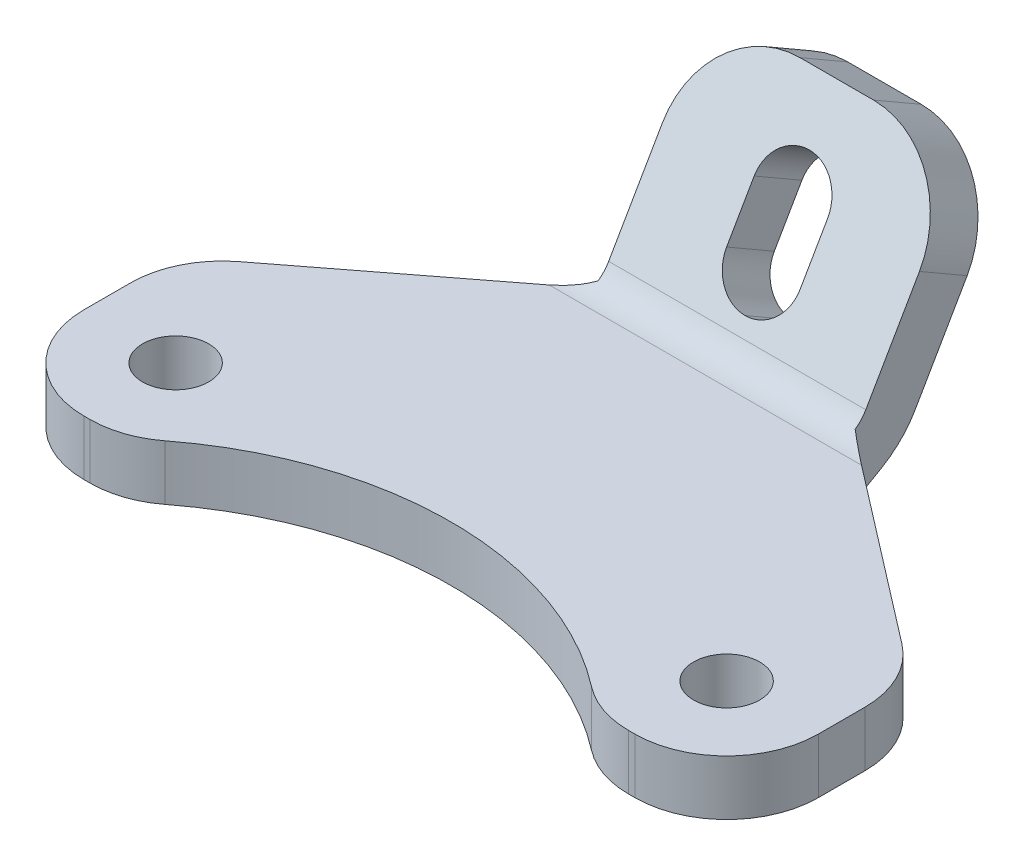
from build123d import *

# Parameters (mm, degrees)
BOSS_EXTRUDE1_DEPTH = 3
SKETCH3_R           = 1.8
CUT_EXTRUDE1_DEPTH  = 3
SKETCH4_W           = 14
SKETCH4_H           = 12
BOSS_EXTRUDE2_DEPTH = 3
BOSS_EXTRUDE3_DEPTH = 14
SKETCH6_W           = 4
SKETCH6_H           = 7
CUT_EXTRUDE2_DEPTH  = 3
FILLET1_R           = 2
FILLET2_R           = 5
FILLET3_R           = 5
FILLET4_R           = 5
SKETCH7_R           = 19
CUT_EXTRUDE3_DEPTH  = 3
FILLET5_R           = 5
FILLET7_R           = 2


with BuildPart() as part:
    # Sketch2 → Boss-Extrude1 (new body)
    with BuildSketch(Plane(origin=(0, 0, 0), x_dir=(1, 0, 0), z_dir=(0, 1, 0))):
        Polygon((0, 10), (13, 20), (27, 20), (40, 10), (40, 0), (0, 0), align=None)
    extrude(amount=BOSS_EXTRUDE1_DEPTH)

    # Sketch3 → Cut-Extrude1 (cut)
    with BuildSketch(Plane(origin=(0, 3, 0), x_dir=(1, 0, 0), z_dir=(0, 1, 0))):
        with Locations(Location((5, 5, 0), (0, 0, 270))):
            Circle(SKETCH3_R)
        with Locations(Location((35, 5, 0), (0, 0, 270))):
            Circle(SKETCH3_R)
    extrude(amount=-CUT_EXTRUDE1_DEPTH, mode=Mode.SUBTRACT)



with BuildPart() as body_2:
    # Sketch4 → Boss-Extrude2 (new body)
    with BuildSketch(Plane(origin=(0, -7.910254038, -13.700961894), x_dir=(-1, 0, 0), z_dir=(0, -0.5000000000000041, -0.8660254037844364))):
        with Locations((-20, 18.598076211)):
            Rectangle(SKETCH4_W, SKETCH4_H)
    extrude(amount=BOSS_EXTRUDE2_DEPTH)


with BuildPart() as part_1:
    add(part.part)

    add(body_2.part)  # Boss-Extrude3 merges body 2
    # Sketch5 → Boss-Extrude3 (add)
    with BuildSketch(Plane.ZY.offset(-13)):
        Polygon((-22.598076211, 1.5), (-20, 0), (-20, 3), align=None)
    extrude(amount=-BOSS_EXTRUDE3_DEPTH)

    # Sketch6 → Cut-Extrude2 (cut)
    with BuildSketch(Plane(origin=(0, -7.910254038, -13.700961894), x_dir=(1, 0, 0), z_dir=(0, 0.5000000000000042, 0.8660254037844363))):
        with Locations((20, 18.098076211)):
            Rectangle(SKETCH6_W, SKETCH6_H)
    extrude(amount=-CUT_EXTRUDE2_DEPTH, mode=Mode.SUBTRACT)

    # Fillet1
    fillet1_edges = [part_1.edges().sort_by_distance(p)[0] for p in [
        (22, 3.982050808, -22.299038106),
        (18, 3.982050808, -22.299038106),
        (18, 10.044228634, -25.799038106),
        (22, 10.044228634, -25.799038106),
    ]]
    fillet(fillet1_edges, radius=FILLET1_R - 0.0001)  # a hair under: the kernel refuses the full size

    # Fillet2
    fillet2_edges = [part_1.edges().sort_by_distance(p)[0] for p in [
        (13, 12.642304845, -27.299038106),
        (27, 12.642304845, -27.299038106),
    ]]
    fillet(fillet2_edges, radius=FILLET2_R)

    # Fillet3
    fillet3_edges = [part_1.edges().sort_by_distance(p)[0] for p in [
        (0, 1.5, -10),
        (40, 1.5, -10),
        (40, 1.5, 0),
        (0, 1.5, 0),
    ]]
    fillet(fillet3_edges, radius=FILLET3_R)

    # Fillet4
    fillet4_edges = [part_1.edges().sort_by_distance(p)[0] for p in [
        (20, 1.5, -22.598076211),
    ]]
    fillet(fillet4_edges, radius=FILLET4_R)

    # Sketch7 → Cut-Extrude3 (cut)
    with BuildSketch(Plane(origin=(0, 3, 0), x_dir=(1, 0, 0), z_dir=(0, 1, 0))):
        with Locations((20, -14)):
            Circle(SKETCH7_R)
    extrude(amount=-CUT_EXTRUDE3_DEPTH, mode=Mode.SUBTRACT)

    # Fillet5
    fillet5_edges = [part_1.edges().sort_by_distance(p)[0] for p in [
        (7.154767421, 1.5, 0),
        (32.845232579, 1.5, 0),
    ]]
    fillet(fillet5_edges, radius=FILLET5_R)

    # Fillet7
    fillet7_edges = [part_1.edges().sort_by_distance(p)[0] for p in [
        (20, 3, -20),
    ]]
    fillet(fillet7_edges, radius=FILLET7_R)


solid = part_1.part
